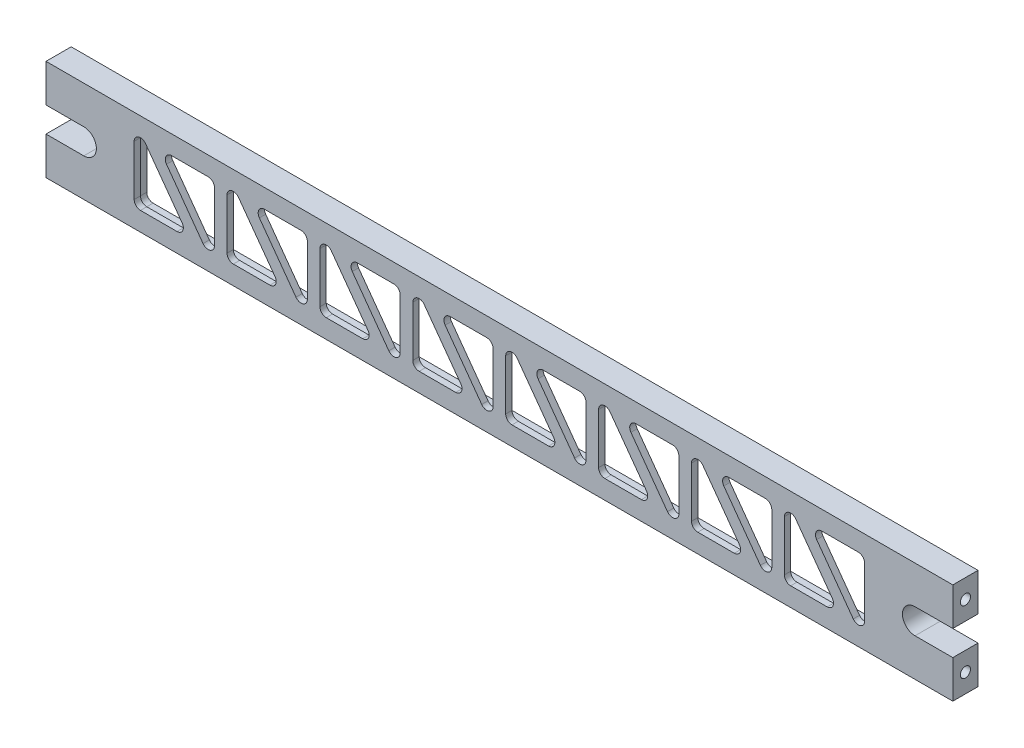
from build123d import *

# Parameters (mm, degrees)
SKETCH1_W                             = 12.7
SKETCH1_H                             = 50.8
BOSS_EXTRUDE1_DEPTH                   = 228.6
F_1_4_20_TAPPED_HOLE1_D               = 5.1054
F_1_4_20_TAPPED_HOLE1_DEPTH           = 29.21
F_1_4_20_TAPPED_HOLE1_TIP             = 1.533816902
F_1_4_20_TAPPED_HOLE1_ON_FACE_2_D     = 5.1054
F_1_4_20_TAPPED_HOLE1_ON_FACE_2_DEPTH = 29.21
F_1_4_20_TAPPED_HOLE1_ON_FACE_2_TIP   = 1.533816902
CUT_EXTRUDE1_DEPTH                    = 9.525
CUT_EXTRUDE2_DEPTH                    = 235.370061281
CUT_EXTRUDE3_DEPTH                    = 235.52055347


with BuildPart() as part:
    # Sketch1 → Boss-Extrude1 (new, symmetric)
    with BuildSketch(Plane(origin=(0, 0, 0), x_dir=(0, 0, -1), z_dir=(1, 0, 0))):
        with Locations((6.35, 25.4)):
            Rectangle(SKETCH1_W, SKETCH1_H)
    extrude(amount=BOSS_EXTRUDE1_DEPTH, both=True)

    # 1/4-20 Tapped Hole1
    with Locations(Plane(origin=(228.6, 41.275, -6.35), x_dir=(0, 0, 1), z_dir=(1, 0, 0))):
        with Locations((0, 0), (0, 31.75)):
            Hole(F_1_4_20_TAPPED_HOLE1_D / 2, depth=F_1_4_20_TAPPED_HOLE1_DEPTH)
            with Locations((0, 0, -(F_1_4_20_TAPPED_HOLE1_DEPTH + F_1_4_20_TAPPED_HOLE1_TIP / 2))):  # 118° drill point
                Cone(0, F_1_4_20_TAPPED_HOLE1_D / 2, F_1_4_20_TAPPED_HOLE1_TIP, mode=Mode.SUBTRACT)

    # 1/4-20 Tapped Hole1 on face 2
    with Locations(Plane(origin=(-228.6, 9.525, -6.35), x_dir=(0, 0, -1), z_dir=(-1, 0, 0))):
        with Locations((0, 0), (0, -31.75)):
            Hole(F_1_4_20_TAPPED_HOLE1_ON_FACE_2_D / 2, depth=F_1_4_20_TAPPED_HOLE1_ON_FACE_2_DEPTH)
            with Locations((0, 0, -(F_1_4_20_TAPPED_HOLE1_ON_FACE_2_DEPTH + F_1_4_20_TAPPED_HOLE1_ON_FACE_2_TIP / 2))):  # 118° drill point
                Cone(0, F_1_4_20_TAPPED_HOLE1_ON_FACE_2_D / 2, F_1_4_20_TAPPED_HOLE1_ON_FACE_2_TIP, mode=Mode.SUBTRACT)

    # Sketch4 → Cut-Extrude1 (cut)
    with BuildSketch(Plane(origin=(0, 0, -12.7), x_dir=(-1, 0, 0), z_dir=(0, 0, -1))):
        with BuildLine():
            Line((187.325, 47.625), (-187.325, 47.625))
            ThreePointArc((-187.325, 47.625), (-189.57006403, 46.69506403), (-190.5, 44.45))
            Line((-190.5, 44.45), (-190.5, 6.35))
            ThreePointArc((-190.5, 6.35), (-189.57006403, 4.10493597), (-187.325, 3.175))
            Line((-187.325, 3.175), (187.325, 3.175))
            ThreePointArc((187.325, 3.175), (189.57006403, 4.10493597), (190.5, 6.35))
            Line((190.5, 6.35), (190.5, 44.45))
            ThreePointArc((190.5, 44.45), (189.57006403, 46.69506403), (187.325, 47.625))
        make_face()
    extrude(amount=-CUT_EXTRUDE1_DEPTH, mode=Mode.SUBTRACT)

    # Sketch5 → Cut-Extrude2 (cut, through all)
    with BuildSketch(Plane(origin=(0, 0, -3.175), x_dir=(-1, 0, 0), z_dir=(0, 0, -1))):
        with BuildLine():
            Line((-184.15, 38.1), (-184.15, 12.7))
            ThreePointArc((-184.15, 12.7), (-181.955497471, 9.680190451), (-178.405590734, 10.834856299))
            Line((-178.405590734, 10.834856299), (-159.967636675, 36.234856299))
            ThreePointArc((-159.967636675, 36.234856299), (-159.70840172, 39.542011399), (-162.53704594, 41.275))
            Line((-162.53704594, 41.275), (-180.975, 41.275))
            ThreePointArc((-180.975, 41.275), (-183.22006403, 40.34506403), (-184.15, 38.1))
        make_face()
        with BuildLine():
            Line((-167.851113325, 14.565143701), (-149.413159266, 39.965143701))
            ThreePointArc((-149.413159266, 39.965143701), (-145.863252529, 41.119809549), (-143.66875, 38.1))
            Line((-143.66875, 38.1), (-143.66875, 12.7))
            ThreePointArc((-143.66875, 12.7), (-144.59868597, 10.45493597), (-146.84375, 9.525))
            Line((-146.84375, 9.525), (-165.28170406, 9.525))
            ThreePointArc((-165.28170406, 9.525), (-168.11034828, 11.257988601), (-167.851113325, 14.565143701))
        make_face()
        with BuildLine():
            Line((-137.31875, 38.1), (-137.31875, 12.7))
            ThreePointArc((-137.31875, 12.7), (-135.124247471, 9.680190451), (-131.574340734, 10.834856299))
            Line((-131.574340734, 10.834856299), (-113.136386675, 36.234856299))
            ThreePointArc((-113.136386675, 36.234856299), (-112.87715172, 39.542011399), (-115.70579594, 41.275))
            Line((-115.70579594, 41.275), (-134.14375, 41.275))
            ThreePointArc((-134.14375, 41.275), (-136.38881403, 40.34506403), (-137.31875, 38.1))
        make_face()
        with BuildLine():
            Line((-121.019863325, 14.565143701), (-102.581909266, 39.965143701))
            ThreePointArc((-102.581909266, 39.965143701), (-99.032002529, 41.119809549), (-96.8375, 38.1))
            Line((-96.8375, 38.1), (-96.8375, 12.7))
            ThreePointArc((-96.8375, 12.7), (-97.76743597, 10.45493597), (-100.0125, 9.525))
            Line((-100.0125, 9.525), (-118.45045406, 9.525))
            ThreePointArc((-118.45045406, 9.525), (-121.27909828, 11.257988601), (-121.019863325, 14.565143701))
        make_face()
        with BuildLine():
            Line((-90.4875, 38.1), (-90.4875, 12.7))
            ThreePointArc((-90.4875, 12.7), (-88.292997471, 9.680190451), (-84.743090734, 10.834856299))
            Line((-84.743090734, 10.834856299), (-66.305136675, 36.234856299))
            ThreePointArc((-66.305136675, 36.234856299), (-66.04590172, 39.542011399), (-68.87454594, 41.275))
            Line((-68.87454594, 41.275), (-87.3125, 41.275))
            ThreePointArc((-87.3125, 41.275), (-89.55756403, 40.34506403), (-90.4875, 38.1))
        make_face()
        with BuildLine():
            Line((-74.188613325, 14.565143701), (-55.750659266, 39.965143701))
            ThreePointArc((-55.750659266, 39.965143701), (-52.200752529, 41.119809549), (-50.00625, 38.1))
            Line((-50.00625, 38.1), (-50.00625, 12.7))
            ThreePointArc((-50.00625, 12.7), (-50.93618597, 10.45493597), (-53.18125, 9.525))
            Line((-53.18125, 9.525), (-71.61920406, 9.525))
            ThreePointArc((-71.61920406, 9.525), (-74.44784828, 11.257988601), (-74.188613325, 14.565143701))
        make_face()
        with BuildLine():
            Line((-43.65625, 38.1), (-43.65625, 12.7))
            ThreePointArc((-43.65625, 12.7), (-41.461747471, 9.680190451), (-37.911840734, 10.834856299))
            Line((-37.911840734, 10.834856299), (-19.473886675, 36.234856299))
            ThreePointArc((-19.473886675, 36.234856299), (-19.21465172, 39.542011399), (-22.04329594, 41.275))
            Line((-22.04329594, 41.275), (-40.48125, 41.275))
            ThreePointArc((-40.48125, 41.275), (-42.72631403, 40.34506403), (-43.65625, 38.1))
        make_face()
        with BuildLine():
            Line((-27.357363325, 14.565143701), (-8.919409266, 39.965143701))
            ThreePointArc((-8.919409266, 39.965143701), (-5.369502529, 41.119809549), (-3.175, 38.1))
            Line((-3.175, 38.1), (-3.175, 12.7))
            ThreePointArc((-3.175, 12.7), (-4.10493597, 10.45493597), (-6.35, 9.525))
            Line((-6.35, 9.525), (-24.78795406, 9.525))
            ThreePointArc((-24.78795406, 9.525), (-27.61659828, 11.257988601), (-27.357363325, 14.565143701))
        make_face()
        with BuildLine():
            Line((3.175, 38.1), (3.175, 12.7))
            ThreePointArc((3.175, 12.7), (5.369502529, 9.680190451), (8.919409266, 10.834856299))
            Line((8.919409266, 10.834856299), (27.357363325, 36.234856299))
            ThreePointArc((27.357363325, 36.234856299), (27.61659828, 39.542011399), (24.78795406, 41.275))
            Line((24.78795406, 41.275), (6.35, 41.275))
            ThreePointArc((6.35, 41.275), (4.10493597, 40.34506403), (3.175, 38.1))
        make_face()
        with BuildLine():
            Line((19.473886675, 14.565143701), (37.911840734, 39.965143701))
            ThreePointArc((37.911840734, 39.965143701), (41.461747471, 41.119809549), (43.65625, 38.1))
            Line((43.65625, 38.1), (43.65625, 12.7))
            ThreePointArc((43.65625, 12.7), (42.72631403, 10.45493597), (40.48125, 9.525))
            Line((40.48125, 9.525), (22.04329594, 9.525))
            ThreePointArc((22.04329594, 9.525), (19.21465172, 11.257988601), (19.473886675, 14.565143701))
        make_face()
        with BuildLine():
            Line((50.00625, 38.1), (50.00625, 12.7))
            ThreePointArc((50.00625, 12.7), (52.200752529, 9.680190451), (55.750659266, 10.834856299))
            Line((55.750659266, 10.834856299), (74.188613325, 36.234856299))
            ThreePointArc((74.188613325, 36.234856299), (74.44784828, 39.542011399), (71.61920406, 41.275))
            Line((71.61920406, 41.275), (53.18125, 41.275))
            ThreePointArc((53.18125, 41.275), (50.93618597, 40.34506403), (50.00625, 38.1))
        make_face()
        with BuildLine():
            Line((66.305136675, 14.565143701), (84.743090734, 39.965143701))
            ThreePointArc((84.743090734, 39.965143701), (88.292997471, 41.119809549), (90.4875, 38.1))
            Line((90.4875, 38.1), (90.4875, 12.7))
            ThreePointArc((90.4875, 12.7), (89.55756403, 10.45493597), (87.3125, 9.525))
            Line((87.3125, 9.525), (68.87454594, 9.525))
            ThreePointArc((68.87454594, 9.525), (66.04590172, 11.257988601), (66.305136675, 14.565143701))
        make_face()
        with BuildLine():
            Line((96.8375, 38.1), (96.8375, 12.7))
            ThreePointArc((96.8375, 12.7), (99.032002529, 9.680190451), (102.581909266, 10.834856299))
            Line((102.581909266, 10.834856299), (121.019863325, 36.234856299))
            ThreePointArc((121.019863325, 36.234856299), (121.27909828, 39.542011399), (118.45045406, 41.275))
            Line((118.45045406, 41.275), (100.0125, 41.275))
            ThreePointArc((100.0125, 41.275), (97.76743597, 40.34506403), (96.8375, 38.1))
        make_face()
        with BuildLine():
            Line((113.136386675, 14.565143701), (131.574340734, 39.965143701))
            ThreePointArc((131.574340734, 39.965143701), (135.124247471, 41.119809549), (137.31875, 38.1))
            Line((137.31875, 38.1), (137.31875, 12.7))
            ThreePointArc((137.31875, 12.7), (136.38881403, 10.45493597), (134.14375, 9.525))
            Line((134.14375, 9.525), (115.70579594, 9.525))
            ThreePointArc((115.70579594, 9.525), (112.87715172, 11.257988601), (113.136386675, 14.565143701))
        make_face()
        with BuildLine():
            Line((143.66875, 38.1), (143.66875, 12.7))
            ThreePointArc((143.66875, 12.7), (145.863252529, 9.680190451), (149.413159266, 10.834856299))
            Line((149.413159266, 10.834856299), (167.851113325, 36.234856299))
            ThreePointArc((167.851113325, 36.234856299), (168.11034828, 39.542011399), (165.28170406, 41.275))
            Line((165.28170406, 41.275), (146.84375, 41.275))
            ThreePointArc((146.84375, 41.275), (144.59868597, 40.34506403), (143.66875, 38.1))
        make_face()
        with BuildLine():
            Line((159.967636675, 14.565143701), (178.405590734, 39.965143701))
            ThreePointArc((178.405590734, 39.965143701), (181.955497471, 41.119809549), (184.15, 38.1))
            Line((184.15, 38.1), (184.15, 12.7))
            ThreePointArc((184.15, 12.7), (183.22006403, 10.45493597), (180.975, 9.525))
            Line((180.975, 9.525), (162.53704594, 9.525))
            ThreePointArc((162.53704594, 9.525), (159.70840172, 11.257988601), (159.967636675, 14.565143701))
        make_face()
    extrude(amount=-CUT_EXTRUDE2_DEPTH, mode=Mode.SUBTRACT)

    # Sketch6 → Cut-Extrude3 (cut, through all)
    with BuildSketch(Plane.XY):
        with BuildLine():
            Line((-209.55, 31.75), (-228.6, 31.75))
            Line((-228.6, 31.75), (-228.6, 19.05))
            Line((-228.6, 19.05), (-209.55, 19.05))
            ThreePointArc((-209.55, 19.05), (-203.2, 25.4), (-209.55, 31.75))
        make_face()
        with BuildLine():
            Line((228.6, 19.05), (209.55, 19.05))
            ThreePointArc((209.55, 19.05), (203.2, 25.4), (209.55, 31.75))
            Line((209.55, 31.75), (228.6, 31.75))
            Line((228.6, 31.75), (228.6, 19.05))
        make_face()
    extrude(amount=-CUT_EXTRUDE3_DEPTH, mode=Mode.SUBTRACT)


solid = part.part
